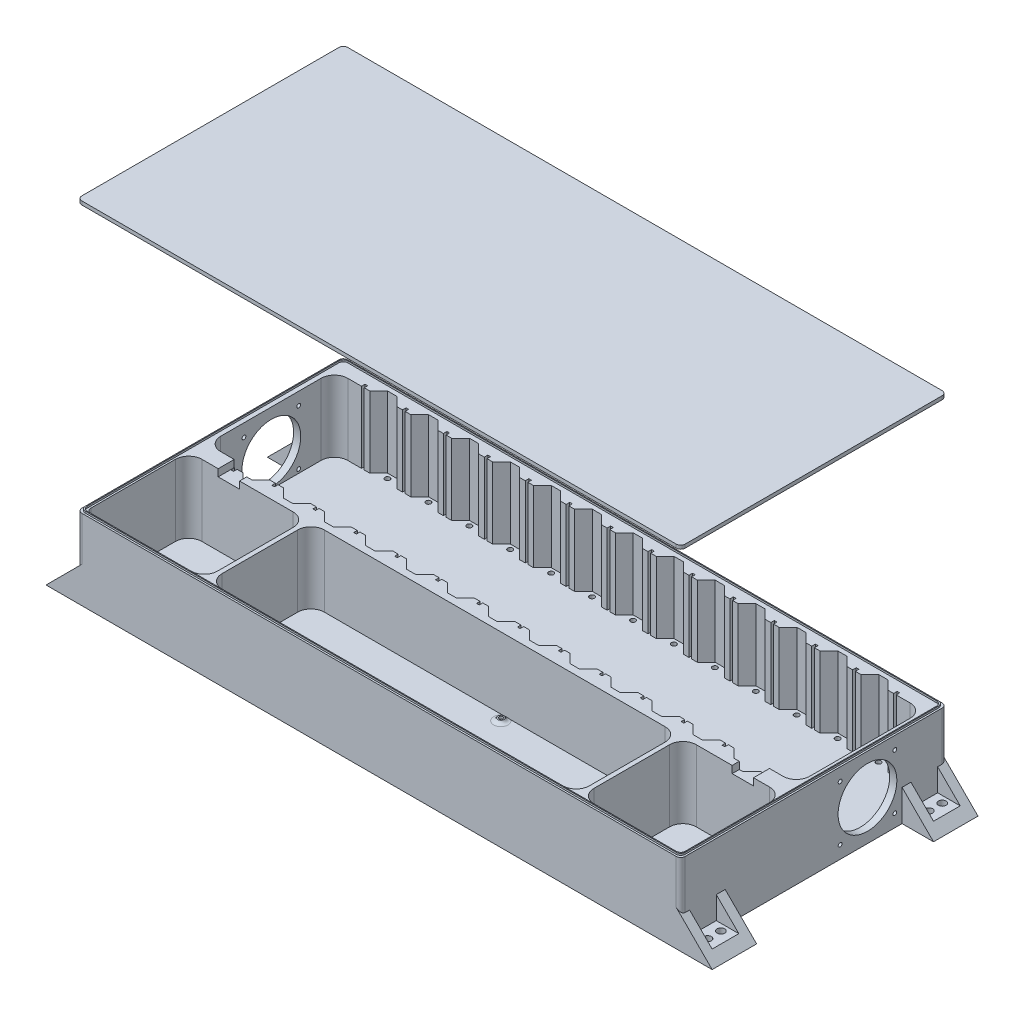
from build123d import *

# Parameters (mm, degrees)
SZKIC1_W                                   = 678
SZKIC1_H                                   = 178.8
DODANIE_WYCI_GNI_CIE1_DEPTH                = 10
DODANIE_WYCI_GNI_CIE2_START                = 10
SZKIC1_8_W                                 = 678
SZKIC1_8_H                                 = 178.8
DODANIE_WYCI_GNI_CIE2_DEPTH                = 80
WYTNIJ_WYCI_GNI_CIE2_START                 = 5
SZKIC1_9_R                                 = 2.8
WYTNIJ_WYCI_GNI_CIE2_DEPTH                 = 5
SZKIC2_R                                   = 2.15
SZKIC2_R_2                                 = 33.037733863
WYTNIJ_WYCI_GNI_CIE3_DEPTH                 = 800
SZKIC3_W                                   = 668
SZKIC3_H                                   = 115
DODANIE_WYCI_GNI_CIE3_DEPTH                = 10
DODANIE_WYCI_GNI_CIE4_DEPTH                = 90
DODANIE_WYCI_GNI_CIE5_DEPTH                = 50
SZKIC6_W                                   = 30
SZKIC6_H                                   = 25.355339059
WYTNIJ_WYCI_GNI_CIE4_DEPTH                 = 40
SZKIC7_R                                   = 4.25
WYTNIJ_WYCI_GNI_CIE5_DEPTH                 = 40
LUSTRO1_AT_THE_SECOND_PLANE_COPY_1_DEPTH   = 50
LUSTRO1_AT_THE_SECOND_PLANE_COPY_2_SKETC_W = 30
LUSTRO1_AT_THE_SECOND_PLANE_COPY_2_SKETC_H = 25.355339059
LUSTRO1_AT_THE_SECOND_PLANE_COPY_2_DEPTH   = 40
LUSTRO1_AT_THE_SECOND_PLANE_COPY_3_SKETC_R = 4.25
LUSTRO1_AT_THE_SECOND_PLANE_COPY_3_DEPTH   = 40
SZKIC9_W                                   = 5
SZKIC9_H                                   = 115
WYCI_GNI_CIE_CIENKA_CIANKA1_DEPTH          = 80
SZKIC8_R                                   = 3.5
SZKIC8_R_2                                 = 2.1
DODANIE_WYCI_GNI_CIE6_DEPTH                = 3
ZAOKR_GLENIE2_R                            = 5
SZKIC10_W                                  = 674
SZKIC10_H                                  = 294.8
SZKIC10_W_2                                = 672
SZKIC10_H_2                                = 292.8
WYCI_GNI_CIE_CIENKA_CIANKA2_DEPTH          = 2
SZKIC14_W                                  = 3
SZKIC14_H                                  = 4
WYCI_CIE_WYCI_GNI_CIE_CIENKA_CIANKA2_DEPTH = 80
SZKIC11_W                                  = 678
SZKIC11_H                                  = 298.8
DODANIE_WYCI_GNI_CIE7_DEPTH                = 4
SZKIC12_W                                  = 674.2
SZKIC12_H                                  = 295
SZKIC12_W_2                                = 671.8
SZKIC12_H_2                                = 292.6
WYCI_CIE_WYCI_GNI_CIE_CIENKA_CIANKA1_DEPTH = 2
ZAOKR_GLENIE3_R                            = 5
ZAOKR_GLENIE4_R                            = 5
ZAOKR_GLENIE5_R                            = 15
SZKIC13_W                                  = 24
SZKIC13_H                                  = 10
WYTNIJ_WYCI_GNI_CIE7_DEPTH                 = 30


with BuildPart() as part:
    # Szkic1 → Dodanie-wyciągnięcie1 (new body)
    with BuildSketch(Plane(origin=(0, 0, 0), x_dir=(1, 0, 0), z_dir=(0, 1, 0))):
        with Locations((287.5, -56)):
            Rectangle(SZKIC1_W, SZKIC1_H)
    extrude(amount=DODANIE_WYCI_GNI_CIE1_DEPTH)

    # Szkic1<8> → Dodanie-wyciągnięcie2 (add)
    with BuildSketch(Plane(origin=(0, 0, 0), x_dir=(1, 0, 0), z_dir=(0, 1, 0)).offset(DODANIE_WYCI_GNI_CIE2_START)):
        with Locations((287.5, -56)):
            Rectangle(SZKIC1_8_W, SZKIC1_8_H)
        Polygon((-43.5, 15.4), (-3.665685425, 15.4), (6.334314575, 25.4), (16.665685425, 25.4), (26.665685425, 15.4), (34.5, 15.4), (42.334314575, 15.4), (52.334314575, 25.4), (62.665685425, 25.4), (72.665685425, 15.4), (80.5, 15.4), (88.334314575, 15.4), (98.334314575, 25.4), (108.665685425, 25.4), (118.665685425, 15.4), (126.5, 15.4), (134.334314575, 15.4), (144.334314575, 25.4), (154.665685425, 25.4), (164.665685425, 15.4), (172.5, 15.4), (180.334314575, 15.4), (190.334314575, 25.4), (200.665685425, 25.4), (210.665685425, 15.4), (218.5, 15.4), (226.334314575, 15.4), (236.334314575, 25.4), (246.665685425, 25.4), (256.665685425, 15.4), (264.5, 15.4), (272.334314575, 15.4), (282.334314575, 25.4), (292.665685425, 25.4), (302.665685425, 15.4), (310.5, 15.4), (318.334314575, 15.4), (328.334314575, 25.4), (338.665685425, 25.4), (348.665685425, 15.4), (356.5, 15.4), (364.334314575, 15.4), (374.334314575, 25.4), (384.665685425, 25.4), (394.665685425, 15.4), (402.5, 15.4), (410.334314575, 15.4), (420.334314575, 25.4), (430.665685425, 25.4), (440.665685425, 15.4), (448.5, 15.4), (456.334314575, 15.4), (466.334314575, 25.4), (476.665685425, 25.4), (486.665685425, 15.4), (494.5, 15.4), (502.334314575, 15.4), (512.334314575, 25.4), (522.665685425, 25.4), (532.665685425, 15.4), (540.5, 15.4), (548.334314575, 15.4), (558.334314575, 25.4), (568.665685425, 25.4), (578.665685425, 15.4), (618.5, 15.4), (618.5, -127.4), (578.665685425, -127.4), (568.665685425, -137.4), (558.334314575, -137.4), (548.334314575, -127.4), (540.5, -127.4), (532.665685425, -127.4), (522.665685425, -137.4), (512.334314575, -137.4), (502.334314575, -127.4), (494.5, -127.4), (486.665685425, -127.4), (476.665685425, -137.4), (466.334314575, -137.4), (456.334314575, -127.4), (448.5, -127.4), (440.665685425, -127.4), (430.665685425, -137.4), (420.334314575, -137.4), (410.334314575, -127.4), (402.5, -127.4), (394.665685425, -127.4), (384.665685425, -137.4), (374.334314575, -137.4), (364.334314575, -127.4), (356.5, -127.4), (348.665685425, -127.4), (338.665685425, -137.4), (328.334314575, -137.4), (318.334314575, -127.4), (310.5, -127.4), (302.665685425, -127.4), (292.665685425, -137.4), (282.334314575, -137.4), (272.334314575, -127.4), (264.5, -127.4), (256.665685425, -127.4), (246.665685425, -137.4), (236.334314575, -137.4), (226.334314575, -127.4), (218.5, -127.4), (210.665685425, -127.4), (200.665685425, -137.4), (190.334314575, -137.4), (180.334314575, -127.4), (172.5, -127.4), (164.665685425, -127.4), (154.665685425, -137.4), (144.334314575, -137.4), (134.334314575, -127.4), (126.5, -127.4), (118.665685425, -127.4), (108.665685425, -137.4), (98.334314575, -137.4), (88.334314575, -127.4), (80.5, -127.4), (72.665685425, -127.4), (62.665685425, -137.4), (52.334314575, -137.4), (42.334314575, -127.4), (34.5, -127.4), (26.665685425, -127.4), (16.665685425, -137.4), (6.334314575, -137.4), (-3.665685425, -127.4), (-43.5, -127.4), align=None, mode=Mode.SUBTRACT)
    extrude(amount=DODANIE_WYCI_GNI_CIE2_DEPTH)

    # Szkic1<9> → Wytnij-wyciągnięcie2 (cut)
    with BuildSketch(Plane(origin=(0, 0, 0), x_dir=(1, 0, 0), z_dir=(0, 1, 0)).offset(WYTNIJ_WYCI_GNI_CIE2_START)):
        with Locations(Location((11.5, 20, 0), (0, 0, 270))):
            Circle(SZKIC1_9_R)
        with Locations(Location((11.5, -132, 0), (0, 0, 270))):
            Circle(SZKIC1_9_R)
        with Locations(Location((57.5, 20, 0), (0, 0, 270))):
            Circle(SZKIC1_9_R)
        with Locations(Location((103.5, 20, 0), (0, 0, 270))):
            Circle(SZKIC1_9_R)
        with Locations(Location((149.5, 20, 0), (0, 0, 270))):
            Circle(SZKIC1_9_R)
        with Locations(Location((195.5, 20, 0), (0, 0, 270))):
            Circle(SZKIC1_9_R)
        with Locations(Location((241.5, 20, 0), (0, 0, 270))):
            Circle(SZKIC1_9_R)
        with Locations(Location((287.5, 20, 0), (0, 0, 270))):
            Circle(SZKIC1_9_R)
        with Locations(Location((333.5, 20, 0), (0, 0, 270))):
            Circle(SZKIC1_9_R)
        with Locations(Location((379.5, 20, 0), (0, 0, 270))):
            Circle(SZKIC1_9_R)
        with Locations(Location((425.5, 20, 0), (0, 0, 270))):
            Circle(SZKIC1_9_R)
        with Locations(Location((471.5, 20, 0), (0, 0, 270))):
            Circle(SZKIC1_9_R)
        with Locations(Location((517.5, 20, 0), (0, 0, 270))):
            Circle(SZKIC1_9_R)
        with Locations(Location((563.5, 20, 0), (0, 0, 270))):
            Circle(SZKIC1_9_R)
        with Locations(Location((287.5, -132, 0), (0, 0, 270))):
            Circle(SZKIC1_9_R)
        with Locations(Location((241.5, -132, 0), (0, 0, 270))):
            Circle(SZKIC1_9_R)
        with Locations(Location((195.5, -132, 0), (0, 0, 270))):
            Circle(SZKIC1_9_R)
        with Locations(Location((149.5, -132, 0), (0, 0, 270))):
            Circle(SZKIC1_9_R)
        with Locations(Location((103.5, -132, 0), (0, 0, 270))):
            Circle(SZKIC1_9_R)
        with Locations(Location((57.5, -132, 0), (0, 0, 270))):
            Circle(SZKIC1_9_R)
        with Locations(Location((425.5, -132, 0), (0, 0, 270))):
            Circle(SZKIC1_9_R)
        with Locations(Location((379.5, -132, 0), (0, 0, 270))):
            Circle(SZKIC1_9_R)
        with Locations(Location((333.5, -132, 0), (0, 0, 270))):
            Circle(SZKIC1_9_R)
        with Locations(Location((563.5, -132, 0), (0, 0, 270))):
            Circle(SZKIC1_9_R)
        with Locations(Location((517.5, -132, 0), (0, 0, 270))):
            Circle(SZKIC1_9_R)
        with Locations(Location((471.5, -132, 0), (0, 0, 270))):
            Circle(SZKIC1_9_R)
    extrude(amount=WYTNIJ_WYCI_GNI_CIE2_DEPTH, mode=Mode.SUBTRACT)

    # Szkic2 → Wytnij-wyciągnięcie3 (cut)
    with BuildSketch(Plane.ZY.offset(51.5)):
        with Locations((24.730262514, 75.746998488)):
            Circle(SZKIC2_R)
        with Locations((24.730262514, 14.246998488)):
            Circle(SZKIC2_R)
        with Locations((86.230262514, 14.246998488)):
            Circle(SZKIC2_R)
        with Locations((86.230262514, 75.746998488)):
            Circle(SZKIC2_R)
        with Locations((55.480262514, 44.996998488)):
            Circle(SZKIC2_R_2)
    extrude(amount=-WYTNIJ_WYCI_GNI_CIE3_DEPTH, mode=Mode.SUBTRACT)

    # Szkic3 → Dodanie-wyciągnięcie3 (add)
    with BuildSketch(Plane.XZ):
        Polygon((-51.5, 265.4), (-51.5, 145.4), (-46.5, 145.4), (-46.5, 260.4), (621.5, 260.4), (621.5, 145.4), (626.5, 145.4), (626.5, 265.4), align=None)
        with Locations((287.5, 202.9)):
            Rectangle(SZKIC3_W, SZKIC3_H)
    extrude(amount=-DODANIE_WYCI_GNI_CIE3_DEPTH)

    # Szkic3<4> → Dodanie-wyciągnięcie4 (add)
    with BuildSketch(Plane.XZ):
        Polygon((-51.5, 265.4), (-51.5, 145.4), (-46.5, 145.4), (-46.5, 260.4), (621.5, 260.4), (621.5, 145.4), (626.5, 145.4), (626.5, 265.4), align=None)
    extrude(amount=-DODANIE_WYCI_GNI_CIE4_DEPTH)

    # Szkic5 → Dodanie-wyciągnięcie5 (add)
    with BuildSketch(Plane.XY.offset(265.4)):
        Polygon((-51.5, 0), (-86.855339059, 0), (-51.5, 35.355339059), align=None)
    dodanie_wyci_gni_cie5 = extrude(amount=-DODANIE_WYCI_GNI_CIE5_DEPTH)

    # Szkic6 → Wytnij-wyciągnięcie4 (cut)
    with BuildSketch(Plane.ZY.offset(51.5)):
        with Locations((240.4, 22.67766953)):
            Rectangle(SZKIC6_W, SZKIC6_H)
    wytnij_wyci_gni_cie4 = extrude(amount=WYTNIJ_WYCI_GNI_CIE4_DEPTH, mode=Mode.SUBTRACT)

    # Szkic7 → Wytnij-wyciągnięcie5 (cut)
    with BuildSketch(Plane(origin=(0, 10, 0), x_dir=(1, 0, 0), z_dir=(0, 1, 0))):
        with Locations(Location((-64.17766953, -232.9, 0), (0, 0, 270))):
            Circle(SZKIC7_R)
        with Locations(Location((-64.17766953, -247.9, 0), (0, 0, 270))):
            Circle(SZKIC7_R)
    wytnij_wyci_gni_cie5 = extrude(amount=-WYTNIJ_WYCI_GNI_CIE5_DEPTH, mode=Mode.SUBTRACT)

    # Lustro1: Dodanie-wyciągnięcie5, Wytnij-wyciągnięcie4, Wytnij-wyciągnięcie5 across plane
    add(dodanie_wyci_gni_cie5.mirror(Plane.ZY.offset(-287.5)))
    add(wytnij_wyci_gni_cie4.mirror(Plane.ZY.offset(-287.5)), mode=Mode.SUBTRACT)
    add(wytnij_wyci_gni_cie5.mirror(Plane.ZY.offset(-287.5)), mode=Mode.SUBTRACT)

    # Lustro1 at the second plane: Dodanie-wyciągnięcie5, Wytnij-wyciągnięcie4, Wytnij-wyciągnięcie5 across plane
    add(dodanie_wyci_gni_cie5.mirror(Plane.XY.offset(116)))
    add(wytnij_wyci_gni_cie4.mirror(Plane.XY.offset(116)), mode=Mode.SUBTRACT)
    add(wytnij_wyci_gni_cie5.mirror(Plane.XY.offset(116)), mode=Mode.SUBTRACT)

    # Lustro1 at the second plane copy 1 sketc → Lustro1 at the second plane copy 1 (add)
    with BuildSketch(Plane(origin=(575, 0, -33.4), x_dir=(-1, 0, 0), z_dir=(0, 0, -1))):
        Polygon((-51.5, 0), (-86.855339059, 0), (-51.5, 35.355339059), align=None)
    extrude(amount=-LUSTRO1_AT_THE_SECOND_PLANE_COPY_1_DEPTH)

    # Lustro1 at the second plane copy 2 sketc → Lustro1 at the second plane copy 2 (cut)
    with BuildSketch(Plane(origin=(626.5, 0, 232), x_dir=(0, 0, -1), z_dir=(1, 0, 0))):
        with Locations((240.4, 22.67766953)):
            Rectangle(LUSTRO1_AT_THE_SECOND_PLANE_COPY_2_SKETC_W, LUSTRO1_AT_THE_SECOND_PLANE_COPY_2_SKETC_H)
    extrude(amount=LUSTRO1_AT_THE_SECOND_PLANE_COPY_2_DEPTH, mode=Mode.SUBTRACT)

    # Lustro1 at the second plane copy 3 sketc → Lustro1 at the second plane copy 3 (cut)
    with BuildSketch(Plane(origin=(575, 10, 232), x_dir=(-1, 0, 0), z_dir=(0, 1, 0))):
        with Locations(Location((-64.17766953, -232.9, 0), (0, 0, 270))):
            Circle(LUSTRO1_AT_THE_SECOND_PLANE_COPY_3_SKETC_R)
        with Locations(Location((-64.17766953, -247.9, 0), (0, 0, 270))):
            Circle(LUSTRO1_AT_THE_SECOND_PLANE_COPY_3_SKETC_R)
    extrude(amount=-LUSTRO1_AT_THE_SECOND_PLANE_COPY_3_DEPTH, mode=Mode.SUBTRACT)

    # Szkic9 → Wyciągnięcie-cienka ścianka1 (add)
    with BuildSketch(Plane(origin=(0, 10, 0), x_dir=(1, 0, 0), z_dir=(0, 1, 0))):
        with Locations((506.5, -202.9)):
            Rectangle(SZKIC9_W, SZKIC9_H)
        with Locations((88.5, -202.9)):
            Rectangle(SZKIC9_W, SZKIC9_H)
    extrude(amount=WYCI_GNI_CIE_CIENKA_CIANKA1_DEPTH)

    # Szkic8 → Dodanie-wyciągnięcie6 (add)
    # profile 1 of 5: a face of its own
    with BuildSketch(Plane(origin=(0, 10, 0), x_dir=(1, 0, 0), z_dir=(0, 1, 0))):
        with Locations(Location((310.94686775, -151.982255253, 0), (0, 0, 270))):
            Circle(SZKIC8_R)
        with Locations(Location((310.94686775, -151.982255253, 0), (0, 0, 270))):
            Circle(SZKIC8_R_2, mode=Mode.SUBTRACT)
    # profile 2 of 5: a face of its own
    with BuildSketch(Plane(origin=(0, 10, 0), x_dir=(1, 0, 0), z_dir=(0, 1, 0))):
        with Locations(Location((452.59686775, -151.707255253, 0), (0, 0, 270))):
            Circle(SZKIC8_R)
        with Locations(Location((452.59686775, -151.707255253, 0), (0, 0, 270))):
            Circle(SZKIC8_R_2, mode=Mode.SUBTRACT)
    # profile 3 of 5: a face of its own
    with BuildSketch(Plane(origin=(0, 10, 0), x_dir=(1, 0, 0), z_dir=(0, 1, 0))):
        with Locations(Location((452.62186775, -219.682255253, 0), (0, 0, 270))):
            Circle(SZKIC8_R)
        with Locations(Location((452.62186775, -219.682255253, 0), (0, 0, 270))):
            Circle(SZKIC8_R_2, mode=Mode.SUBTRACT)
    # profile 4 of 5: a face of its own
    with BuildSketch(Plane(origin=(0, 10, 0), x_dir=(1, 0, 0), z_dir=(0, 1, 0))):
        with Locations(Location((331.86359375, -254.590529253, 0), (0, 0, 270))):
            Circle(SZKIC8_R)
        with Locations(Location((331.86359375, -254.590529253, 0), (0, 0, 270))):
            Circle(SZKIC8_R_2, mode=Mode.SUBTRACT)
    # profile 5 of 5: a face of its own
    with BuildSketch(Plane(origin=(0, 10, 0), x_dir=(1, 0, 0), z_dir=(0, 1, 0))):
        with Locations(Location((310.40514175, -200.748981253, 0), (0, 0, 270))):
            Circle(SZKIC8_R)
        with Locations(Location((310.40514175, -200.748981253, 0), (0, 0, 270))):
            Circle(SZKIC8_R_2, mode=Mode.SUBTRACT)
    extrude(amount=DODANIE_WYCI_GNI_CIE6_DEPTH)

    # Zaokrąglenie2
    # the kernel refuses this fillet: 5 mm, written as the material it adds along each edge
    with BuildSketch(Plane(origin=(310.40514175, 10, 200.748981253), x_dir=(0, 0, 1), z_dir=(-1, 0, 0))) as zaokr_glenie2_piece_1:
        with BuildLine():
            CenterArc((8.082575695, 5), ZAOKR_GLENIE2_R, 203.578178478, 66.421821522)
            Line((3.5, 3), (3.5, 0))
            Line((3.5, 0), (8.082575695, 0))
        make_face()
    revolve(axis=Axis((310.40514175, 10, 200.748981253), (0, 1, 0)))
    with BuildSketch(Plane(origin=(331.86359375, 10, 254.590529253), x_dir=(0, 0, 1), z_dir=(-1, 0, 0))) as zaokr_glenie2_piece_2:
        with BuildLine():
            CenterArc((8.082575695, 5), ZAOKR_GLENIE2_R, 203.578178478, 66.421821522)
            Line((3.5, 3), (3.5, 0))
            Line((3.5, 0), (8.082575695, 0))
        make_face()
    revolve(axis=Axis((331.86359375, 10, 254.590529253), (0, 1, 0)))
    with BuildSketch(Plane(origin=(452.62186775, 10, 219.682255253), x_dir=(0, 0, 1), z_dir=(-1, 0, 0))) as zaokr_glenie2_piece_3:
        with BuildLine():
            CenterArc((8.082575695, 5), ZAOKR_GLENIE2_R, 203.578178478, 66.421821522)
            Line((3.5, 3), (3.5, 0))
            Line((3.5, 0), (8.082575695, 0))
        make_face()
    revolve(axis=Axis((452.62186775, 10, 219.682255253), (0, 1, 0)))
    with BuildSketch(Plane(origin=(452.59686775, 10, 151.707255253), x_dir=(0, 0, 1), z_dir=(-1, 0, 0))) as zaokr_glenie2_piece_4:
        with BuildLine():
            CenterArc((8.082575695, 5), ZAOKR_GLENIE2_R, 203.578178478, 66.421821522)
            Line((3.5, 3), (3.5, 0))
            Line((3.5, 0), (8.082575695, 0))
        make_face()
    revolve(axis=Axis((452.59686775, 10, 151.707255253), (0, 1, 0)))
    with BuildSketch(Plane(origin=(310.94686775, 10, 151.982255253), x_dir=(0, 0, 1), z_dir=(-1, 0, 0))) as zaokr_glenie2_piece_5:
        with BuildLine():
            CenterArc((8.082575695, 5), ZAOKR_GLENIE2_R, 203.578178478, 66.421821522)
            Line((3.5, 3), (3.5, 0))
            Line((3.5, 0), (8.082575695, 0))
        make_face()
    revolve(axis=Axis((310.94686775, 10, 151.982255253), (0, 1, 0)))

    # Szkic10 → Wyciągnięcie-cienka ścianka2 (add)
    with BuildSketch(Plane(origin=(0, 90, 0), x_dir=(1, 0, 0), z_dir=(0, 1, 0))):
        with Locations((287.5, -116)):
            Rectangle(SZKIC10_W, SZKIC10_H)
        with Locations((287.5, -116)):
            Rectangle(SZKIC10_W_2, SZKIC10_H_2, mode=Mode.SUBTRACT)
    extrude(amount=WYCI_GNI_CIE_CIENKA_CIANKA2_DEPTH)

    # Szkic14 → Wycięcie-wyciągnięcie-cienka ścianka2 (cut)
    with BuildSketch(Plane(origin=(0, 90, 0), x_dir=(1, 0, 0), z_dir=(0, 1, 0))):
        with Locations((34.5, 17.4)):
            Rectangle(SZKIC14_W, SZKIC14_H)
        with Locations((80.5, 17.4)):
            Rectangle(SZKIC14_W, SZKIC14_H)
        with Locations((126.5, 17.4)):
            Rectangle(SZKIC14_W, SZKIC14_H)
        with Locations((172.5, 17.4)):
            Rectangle(SZKIC14_W, SZKIC14_H)
        with Locations((218.5, 17.4)):
            Rectangle(SZKIC14_W, SZKIC14_H)
        with Locations((264.5, 17.4)):
            Rectangle(SZKIC14_W, SZKIC14_H)
        with Locations((310.5, 17.4)):
            Rectangle(SZKIC14_W, SZKIC14_H)
        with Locations((356.5, 17.4)):
            Rectangle(SZKIC14_W, SZKIC14_H)
        with Locations((402.5, 17.4)):
            Rectangle(SZKIC14_W, SZKIC14_H)
        with Locations((448.5, 17.4)):
            Rectangle(SZKIC14_W, SZKIC14_H)
        with Locations((494.5, 17.4)):
            Rectangle(SZKIC14_W, SZKIC14_H)
        with Locations((540.5, 17.4)):
            Rectangle(SZKIC14_W, SZKIC14_H)
        with Locations((586.5, 17.4)):
            Rectangle(SZKIC14_W, SZKIC14_H)
        with Locations((-11.5, 17.4)):
            Rectangle(SZKIC14_W, SZKIC14_H)
        with Locations((-11.5, -129.4)):
            Rectangle(SZKIC14_W, SZKIC14_H)
        with Locations((586.5, -129.4)):
            Rectangle(SZKIC14_W, SZKIC14_H)
        with Locations((540.5, -129.4)):
            Rectangle(SZKIC14_W, SZKIC14_H)
        with Locations((494.5, -129.4)):
            Rectangle(SZKIC14_W, SZKIC14_H)
        with Locations((448.5, -129.4)):
            Rectangle(SZKIC14_W, SZKIC14_H)
        with Locations((402.5, -129.4)):
            Rectangle(SZKIC14_W, SZKIC14_H)
        with Locations((356.5, -129.4)):
            Rectangle(SZKIC14_W, SZKIC14_H)
        with Locations((310.5, -129.4)):
            Rectangle(SZKIC14_W, SZKIC14_H)
        with Locations((264.5, -129.4)):
            Rectangle(SZKIC14_W, SZKIC14_H)
        with Locations((218.5, -129.4)):
            Rectangle(SZKIC14_W, SZKIC14_H)
        with Locations((172.5, -129.4)):
            Rectangle(SZKIC14_W, SZKIC14_H)
        with Locations((126.5, -129.4)):
            Rectangle(SZKIC14_W, SZKIC14_H)
        with Locations((80.5, -129.4)):
            Rectangle(SZKIC14_W, SZKIC14_H)
        with Locations((34.5, -129.4)):
            Rectangle(SZKIC14_W, SZKIC14_H)
    extrude(amount=-WYCI_CIE_WYCI_GNI_CIE_CIENKA_CIANKA2_DEPTH, mode=Mode.SUBTRACT)

    # Zaokrąglenie3
    zaokr_glenie3_edges = [part.edges().sort_by_distance(p)[0] for p in [
        (-49.5, 91, 263.4),
        (624.5, 91, 263.4),
        (624.5, 91, -31.4),
        (-49.5, 91, -31.4),
        (623.5, 91, 262.4),
        (623.5, 91, -30.4),
        (-48.5, 91, -30.4),
        (-48.5, 91, 262.4),
        (-51.5, 62.67766953, -33.4),
        (626.5, 62.67766953, -33.4),
        (-51.5, 62.67766953, 265.4),
        (626.5, 62.67766953, 265.4),
        (-46.5, 50, 260.4),
        (621.5, 50, 260.4),
    ]]
    fillet(zaokr_glenie3_edges, radius=ZAOKR_GLENIE3_R)

    # Zaokrąglenie5
    zaokr_glenie5_edges = [part.edges().sort_by_distance(p)[0] for p in [
        (618.5, 50, 127.4),
        (618.5, 50, -15.4),
        (-43.5, 50, -15.4),
        (-43.5, 50, 127.4),
        (621.5, 50, 145.4),
        (-46.5, 50, 145.4),
        (509, 50, 145.4),
        (509, 50, 260.4),
        (504, 50, 260.4),
        (504, 50, 145.4),
        (91, 50, 145.4),
        (91, 50, 260.4),
        (86, 50, 260.4),
        (86, 50, 145.4),
    ]]
    fillet(zaokr_glenie5_edges, radius=ZAOKR_GLENIE5_R)

    # Szkic13 → Wytnij-wyciągnięcie7 (cut)
    with BuildSketch(Plane.XY.offset(145.4)):
        with Locations((576.334314575, 87)):
            Rectangle(SZKIC13_W, SZKIC13_H)
        with Locations((-1.334314575, 87)):
            Rectangle(SZKIC13_W, SZKIC13_H)
    extrude(amount=-WYTNIJ_WYCI_GNI_CIE7_DEPTH, mode=Mode.SUBTRACT)


with BuildPart() as body_2:
    # Szkic11 → Dodanie-wyciągnięcie7 (new body)
    with BuildSketch(Plane(origin=(0, 390, 0), x_dir=(1, 0, 0), z_dir=(0, 1, 0))):
        with Locations((287.5, -116)):
            Rectangle(SZKIC11_W, SZKIC11_H)
    extrude(amount=DODANIE_WYCI_GNI_CIE7_DEPTH)

    # Szkic12 → Wycięcie-wyciągnięcie-cienka ścianka1 (cut)
    with BuildSketch(Plane(origin=(0, 390, 0), x_dir=(1, 0, 0), z_dir=(0, 1, 0))):
        with Locations((287.5, -116)):
            Rectangle(SZKIC12_W, SZKIC12_H)
        with Locations((287.5, -116)):
            Rectangle(SZKIC12_W_2, SZKIC12_H_2, mode=Mode.SUBTRACT)
    extrude(amount=WYCI_CIE_WYCI_GNI_CIE_CIENKA_CIANKA1_DEPTH, mode=Mode.SUBTRACT)

    # Zaokrąglenie4
    zaokr_glenie4_edges = [body_2.edges().sort_by_distance(p)[0] for p in [
        (-49.6, 391, 263.5),
        (624.6, 391, 263.5),
        (624.6, 391, -31.5),
        (-49.6, 391, -31.5),
        (623.4, 391, 262.3),
        (623.4, 391, -30.3),
        (-48.4, 391, -30.3),
        (-48.4, 391, 262.3),
        (-51.5, 392, -33.4),
        (626.5, 392, -33.4),
        (626.5, 392, 265.4),
        (-51.5, 392, 265.4),
    ]]
    fillet(zaokr_glenie4_edges, radius=ZAOKR_GLENIE4_R)


solid = Compound([part.part, body_2.part])
